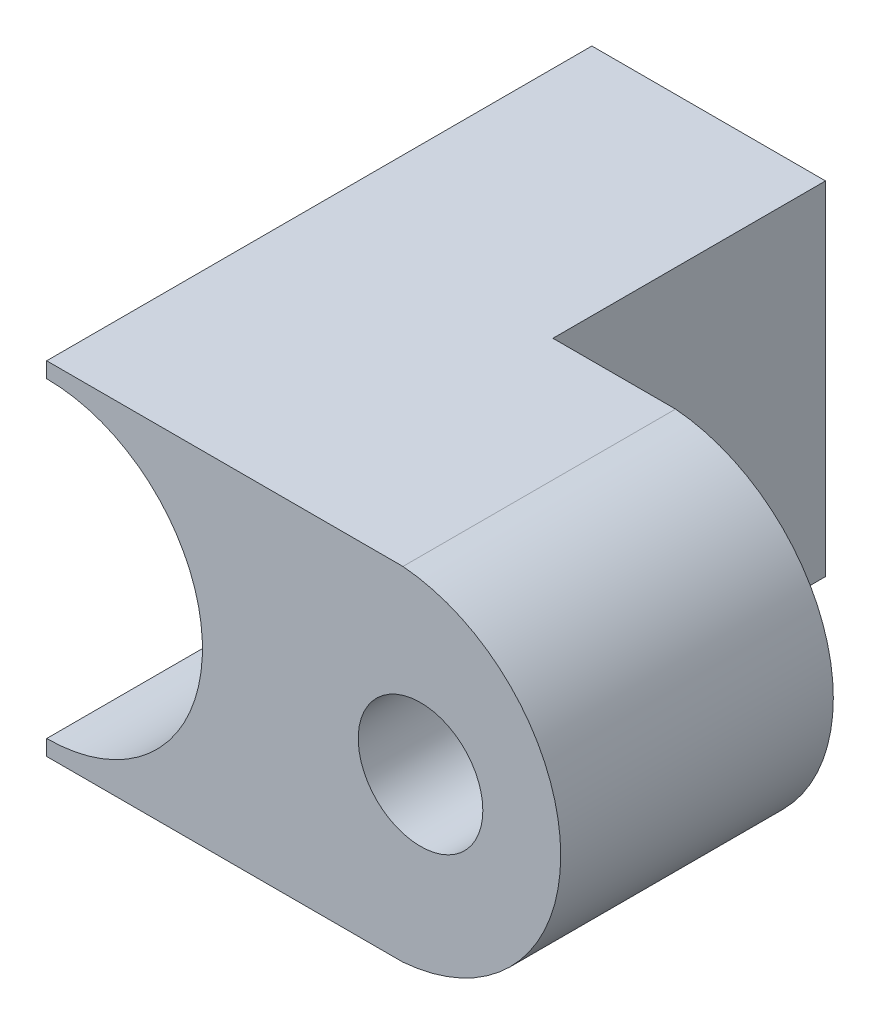
from build123d import *

# Parameters (mm, degrees)
BOSS_EXTRUDE1_DEPTH          = 44.45
CUT_EXTRUDE1_DEPTH           = 22.225
F_3_8_0_375_DIAMETER_HOLE1_D = 10.16


with BuildPart() as part:
    # Sketch1 → Boss-Extrude1 (new body)
    with BuildSketch(Plane.XY):
        with BuildLine():
            Line((0, -1.27), (29.046742048, -1.27))
            ThreePointArc((29.046742048, -1.27), (41.91, 12.7), (29.046742048, 26.67))
            Line((29.046742048, 26.67), (0, 26.67))
            Line((0, 26.67), (0, 25.4))
            ThreePointArc((0, 25.4), (12.7, 12.7), (0, 0))
            Line((0, 0), (0, -1.27))
        make_face()
    extrude(amount=BOSS_EXTRUDE1_DEPTH)

    # Sketch2 → Cut-Extrude1 (cut)
    with BuildSketch(Plane(origin=(0, 0, 0), x_dir=(-1, 0, 0), z_dir=(0, 0, -1))):
        with BuildLine():
            Line((-19.05, -1.27), (-19.05, 26.67))
            Line((-19.05, 26.67), (-29.046742048, 26.67))
            ThreePointArc((-29.046742048, 26.67), (-41.91, 12.7), (-29.046742048, -1.27))
            Line((-29.046742048, -1.27), (-19.05, -1.27))
        make_face()
    extrude(amount=-CUT_EXTRUDE1_DEPTH, mode=Mode.SUBTRACT)

    # 3/8 (0.375) Diameter Hole1 (through all)
    with Locations(Plane.XY.offset(44.45)):
        with Locations((30.48, 12.7)):
            Hole(F_3_8_0_375_DIAMETER_HOLE1_D / 2)


solid = part.part
